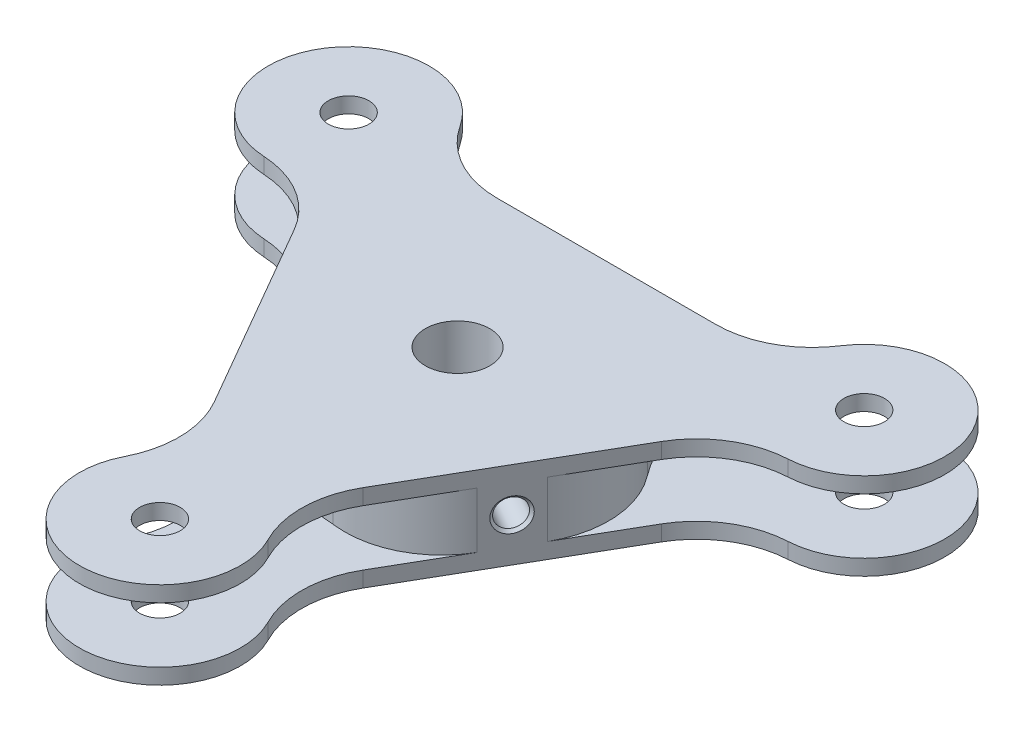
from build123d import *

# Parameters (mm, degrees)
ESQUISSE1_R             = 12.5
ESQUISSE1_R_2           = 5
BOSS_EXTRU_1_DEPTH      = 6.75
ESQUISSE7_R             = 24
ENL_V_MAT_EXTRU_1_DEPTH = 4.325
CONG_6_START            = -4.325
CONG_6_DEPTH            = 8.65
CONG_7_R                = 15
ESQUISSE25_R            = 3.15
ENL_V_MAT_EXTRU_2_DEPTH = 80.892326756


with BuildPart() as part:
    # Esquisse1 → Boss.-Extru.1 (new, symmetric)
    # profile 1 of 16: a face of its own
    with BuildSketch(Plane(origin=(0, 0, 0), x_dir=(1, 0, 0), z_dir=(0, 1, 0))):
        with Locations((-40, 23.094010768)):
            Circle(ESQUISSE1_R)
    # profile 2 of 16: a face of its own
    with BuildSketch(Plane(origin=(0, 0, 0), x_dir=(1, 0, 0), z_dir=(0, 1, 0))):
        with Locations((0, -46.188021535)):
            Circle(ESQUISSE1_R)
    # profile 3 of 16: a face of its own
    with BuildSketch(Plane(origin=(0, 0, 0), x_dir=(1, 0, 0), z_dir=(0, 1, 0))):
        with Locations((40, 23.094010768)):
            Circle(ESQUISSE1_R)
    # profile 4 of 16: a face of its own
    with BuildSketch(Plane(origin=(0, 0, 0), x_dir=(1, 0, 0), z_dir=(0, 1, 0))):
        Polygon((0, -46.188021535), (-40, 23.094010768), (40, 23.094010768), align=None)
        with Locations(Location((0, 0, 0), (0, 0, 270))):
            Circle(ESQUISSE1_R_2, mode=Mode.SUBTRACT)
    # profile 5 of 16: a face of its own
    with BuildSketch(Plane(origin=(0, 0, 0), x_dir=(1, 0, 0), z_dir=(0, 1, 0))):
        with BuildLine():
            ThreePointArc((-33.75, 12.26869322), (-29.174682453, 16.844010768), (-27.5, 23.094010768))
            Line((-27.5, 23.094010768), (-40, 23.094010768))
            Line((-40, 23.094010768), (-33.75, 12.26869322))
        make_face()
    # profile 6 of 16: a face of its own
    with BuildSketch(Plane(origin=(0, 0, 0), x_dir=(1, 0, 0), z_dir=(0, 1, 0))):
        with BuildLine():
            Line((-40, 23.094010768), (-27.5, 23.094010768))
            ThreePointArc((-27.5, 23.094010768), (-50.825317547, 29.344010768), (-33.75, 12.26869322))
            Line((-33.75, 12.26869322), (-40, 23.094010768))
        make_face()
    # profile 7 of 16: a face of its own
    with BuildSketch(Plane(origin=(0, 0, 0), x_dir=(1, 0, 0), z_dir=(0, 1, 0))):
        with BuildLine():
            Line((27.5, 23.094010768), (40, 23.094010768))
            Line((40, 23.094010768), (33.75, 12.26869322))
            ThreePointArc((33.75, 12.26869322), (46.25, 12.26869322), (52.5, 23.094010768))
            ThreePointArc((52.5, 23.094010768), (40, 35.594010768), (27.5, 23.094010768))
        make_face()
    # profile 8 of 16: a face of its own
    with BuildSketch(Plane(origin=(0, 0, 0), x_dir=(1, 0, 0), z_dir=(0, 1, 0))):
        with BuildLine():
            Line((33.75, 12.26869322), (40, 23.094010768))
            Line((40, 23.094010768), (27.5, 23.094010768))
            ThreePointArc((27.5, 23.094010768), (29.174682453, 16.844010768), (33.75, 12.26869322))
        make_face()
    # profile 9 of 16: a face of its own
    with BuildSketch(Plane(origin=(0, 0, 0), x_dir=(1, 0, 0), z_dir=(0, 1, 0))):
        with BuildLine():
            Line((27.5, 23.094010768), (40, 23.094010768))
            Line((40, 23.094010768), (33.75, 12.26869322))
            ThreePointArc((33.75, 12.26869322), (46.25, 12.26869322), (52.5, 23.094010768))
            ThreePointArc((52.5, 23.094010768), (40, 35.594010768), (27.5, 23.094010768))
        make_face()
    # profile 10 of 16: a face of its own
    with BuildSketch(Plane(origin=(0, 0, 0), x_dir=(1, 0, 0), z_dir=(0, 1, 0))):
        with BuildLine():
            Line((33.75, 12.26869322), (40, 23.094010768))
            Line((40, 23.094010768), (27.5, 23.094010768))
            ThreePointArc((27.5, 23.094010768), (29.174682453, 16.844010768), (33.75, 12.26869322))
        make_face()
    # profile 11 of 16: a face of its own
    with BuildSketch(Plane(origin=(0, 0, 0), x_dir=(1, 0, 0), z_dir=(0, 1, 0))):
        with BuildLine():
            ThreePointArc((-33.75, 12.26869322), (-29.174682453, 16.844010768), (-27.5, 23.094010768))
            Line((-27.5, 23.094010768), (-40, 23.094010768))
            Line((-40, 23.094010768), (-33.75, 12.26869322))
        make_face()
    # profile 12 of 16: a face of its own
    with BuildSketch(Plane(origin=(0, 0, 0), x_dir=(1, 0, 0), z_dir=(0, 1, 0))):
        with BuildLine():
            Line((-40, 23.094010768), (-27.5, 23.094010768))
            ThreePointArc((-27.5, 23.094010768), (-50.825317547, 29.344010768), (-33.75, 12.26869322))
            Line((-33.75, 12.26869322), (-40, 23.094010768))
        make_face()
    # profile 13 of 16: a face of its own
    with BuildSketch(Plane(origin=(0, 0, 0), x_dir=(1, 0, 0), z_dir=(0, 1, 0))):
        with BuildLine():
            ThreePointArc((12.5, -46.188021535), (10.825317547, -39.938021535), (6.25, -35.362703988))
            Line((6.25, -35.362703988), (0, -46.188021535))
            Line((0, -46.188021535), (-6.25, -35.362703988))
            ThreePointArc((-6.25, -35.362703988), (-6.25, -57.013339082), (12.5, -46.188021535))
        make_face()
    # profile 14 of 16: a face of its own
    with BuildSketch(Plane(origin=(0, 0, 0), x_dir=(1, 0, 0), z_dir=(0, 1, 0))):
        with BuildLine():
            Line((0, -46.188021535), (6.25, -35.362703988))
            ThreePointArc((6.25, -35.362703988), (0, -33.688021535), (-6.25, -35.362703988))
            Line((-6.25, -35.362703988), (0, -46.188021535))
        make_face()
    # profile 15 of 16: a face of its own
    with BuildSketch(Plane(origin=(0, 0, 0), x_dir=(1, 0, 0), z_dir=(0, 1, 0))):
        with BuildLine():
            ThreePointArc((12.5, -46.188021535), (10.825317547, -39.938021535), (6.25, -35.362703988))
            Line((6.25, -35.362703988), (0, -46.188021535))
            Line((0, -46.188021535), (-6.25, -35.362703988))
            ThreePointArc((-6.25, -35.362703988), (-6.25, -57.013339082), (12.5, -46.188021535))
        make_face()
    # profile 16 of 16: a face of its own
    with BuildSketch(Plane(origin=(0, 0, 0), x_dir=(1, 0, 0), z_dir=(0, 1, 0))):
        with BuildLine():
            Line((0, -46.188021535), (6.25, -35.362703988))
            ThreePointArc((6.25, -35.362703988), (0, -33.688021535), (-6.25, -35.362703988))
            Line((-6.25, -35.362703988), (0, -46.188021535))
        make_face()
    extrude(amount=BOSS_EXTRU_1_DEPTH, both=True)

    # Esquisse7 → Enlèv. mat.-Extru.1 (cut, symmetric)
    with BuildSketch(Plane(origin=(0, 0, 0), x_dir=(1, 0, 0), z_dir=(0, 1, 0))):
        with Locations((-40, 23.094010768)):
            Circle(ESQUISSE7_R)
        with Locations((0, -46.188021535)):
            Circle(ESQUISSE7_R)
        with Locations((40, 23.094010768)):
            Circle(ESQUISSE7_R)
    extrude(amount=ENL_V_MAT_EXTRU_1_DEPTH, both=True, mode=Mode.SUBTRACT)

    # Congé6: read off the stored shape, not the designer's step
    # Congé6 outline → Congé6 (cut)
    with BuildSketch(Plane(origin=(0, 0, 0), x_dir=(1, 0, 0), z_dir=(0, 1, 0)).offset(CONG_6_START)):
        with BuildLine():
            ThreePointArc((4, 23.094010768), (12.320502943, 20.574765183), (17.846153846, 13.863241537))
            ThreePointArc((17.846153846, 13.863241537), (16.466063783, 18.387223525), (16, 23.094010768))
            Line((16, 23.094010768), (4, 23.094010768))
        make_face()
        with BuildLine():
            ThreePointArc((28, 2.309401077), (24.156834569, 5.066417775), (20.928996273, 8.523601822))
            ThreePointArc((20.928996273, 8.523601822), (23.978520797, 0.382485945), (22, -8.082903769))
            Line((22, -8.082903769), (28, 2.309401077))
        make_face()
        with BuildLine():
            ThreePointArc((-17.846153846, 13.863241537), (-12.320502943, 20.574765183), (-4, 23.094010768))
            Line((-4, 23.094010768), (-16, 23.094010768))
            ThreePointArc((-16, 23.094010768), (-16.466063783, 18.387223525), (-17.846153846, 13.863241537))
        make_face()
        with BuildLine():
            Line((12, -25.403411844), (18, -15.011106999))
            ThreePointArc((18, -15.011106999), (11.658017854, -20.957251128), (3.082842427, -22.386843359))
            ThreePointArc((3.082842427, -22.386843359), (7.690770786, -23.453641299), (12, -25.403411844))
        make_face()
        with BuildLine():
            ThreePointArc((-22, -8.082903769), (-23.978520797, 0.382485945), (-20.928996273, 8.523601822))
            ThreePointArc((-20.928996273, 8.523601822), (-24.156834569, 5.066417775), (-28, 2.309401077))
            Line((-28, 2.309401077), (-22, -8.082903769))
        make_face()
        with BuildLine():
            ThreePointArc((-12, -25.403411844), (-7.690770786, -23.453641299), (-3.082842427, -22.386843359))
            ThreePointArc((-3.082842427, -22.386843359), (-11.658017854, -20.957251128), (-18, -15.011106999))
            Line((-18, -15.011106999), (-12, -25.403411844))
        make_face()
    extrude(amount=CONG_6_DEPTH, mode=Mode.SUBTRACT)

    # Trou taraudé M51: read off the stored shape, not the designer's step
    # Trou taraudé M51 outline → Trou taraudé M51 (revolve, cut)
    with BuildSketch(Plane(origin=(0, 0, 0), x_dir=(0.5000000000000003, 0, -0.8660254037844385), z_dir=(0, -1, 0))):
        Polygon((0, 4.537411543), (2.1, 4.537411543), (2.1, 22.669010768), (2.525, 23.094010768), (0, 23.094010768), align=None)
    revolve(axis=Axis((0, 0, 0), (0.8660254037844385, 0, 0.5000000000000003)), mode=Mode.SUBTRACT)

    # Congé7
    cong_7_edges = [part.edges().sort_by_distance(p)[0] for p in [
        (-27.5, 5.5375, -23.094010768),
        (27.5, 5.5375, -23.094010768),
        (33.75, 5.5375, -12.26869322),
        (6.25, 5.5375, 35.362703988),
        (-6.25, 5.5375, 35.362703988),
        (-33.75, 5.5375, -12.26869322),
        (-27.5, -5.5375, -23.094010768),
        (27.5, -5.5375, -23.094010768),
        (33.75, -5.5375, -12.26869322),
        (6.25, -5.5375, 35.362703988),
        (-6.25, -5.5375, 35.362703988),
        (-33.75, -5.5375, -12.26869322),
    ]]
    fillet(cong_7_edges, radius=CONG_7_R)

    # Esquisse25 → Enlèv. mat.-Extru.2 (cut, through all)
    with BuildSketch(Plane(origin=(0, 6.75, 0), x_dir=(1, 0, 0), z_dir=(0, 1, 0))):
        with Locations(Location((-40, 23.094010768, 0), (0, 0, 270))):
            Circle(ESQUISSE25_R)
        with Locations(Location((40, 23.094010768, 0), (0, 0, 270))):
            Circle(ESQUISSE25_R)
        with Locations(Location((0, -46.188021535, 0), (0, 0, 270))):
            Circle(ESQUISSE25_R)
    extrude(amount=-ENL_V_MAT_EXTRU_2_DEPTH, mode=Mode.SUBTRACT)


solid = part.part
